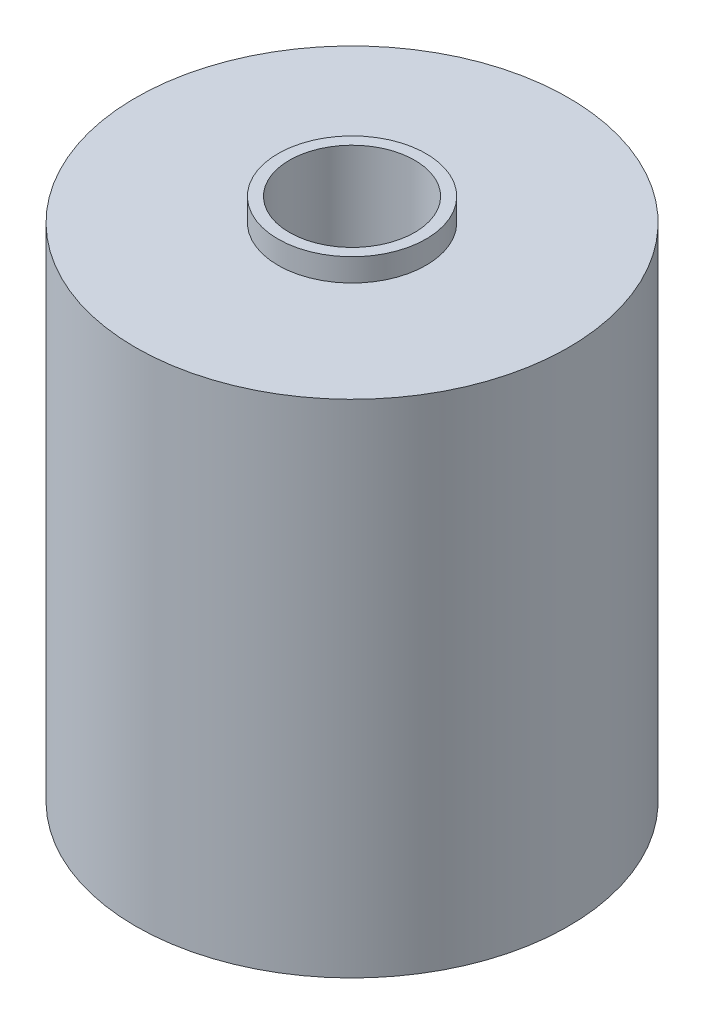
from build123d import *

# Parameters (mm, degrees)
ESBO_O1_R                = 9.5
ESBO_O1_R_2              = 3.25
RESSALTO_EXTRUS_O1_DEPTH = 11
ESBO_O1_3_R              = 3.25
ESBO_O1_3_R_2            = 2.75
RESSALTO_EXTRUS_O2_DEPTH = 12


with BuildPart() as part:
    # Esboço1 → Ressalto-extrusão1 (new, symmetric)
    with BuildSketch(Plane(origin=(0, 0, 0), x_dir=(1, 0, 0), z_dir=(0, 1, 0))):
        Circle(ESBO_O1_R)
        Circle(ESBO_O1_R_2, mode=Mode.SUBTRACT)
    extrude(amount=RESSALTO_EXTRUS_O1_DEPTH, both=True)

    # Esboço1<3> → Ressalto-extrusão2 (add, symmetric)
    with BuildSketch(Plane(origin=(0, 0, 0), x_dir=(1, 0, 0), z_dir=(0, 1, 0))):
        Circle(ESBO_O1_3_R)
        Circle(ESBO_O1_3_R_2, mode=Mode.SUBTRACT)
    extrude(amount=RESSALTO_EXTRUS_O2_DEPTH, both=True)


solid = part.part
